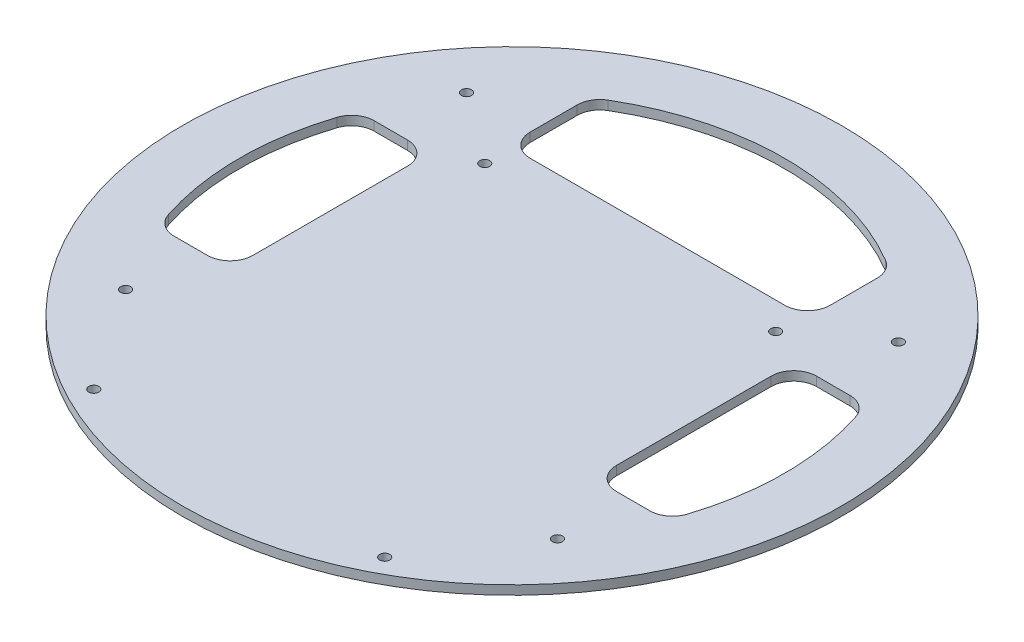
from build123d import *

# Parameters (mm, degrees)
SKETCH_2_R               = 72.5
EXTRUDE_1_DEPTH          = 2
CUT_EXTRUDE_1_DEPTH      = 103.549987811
CUT_EXTRUDE_1_DEPTH_BACK = 103.549987811
SKETCH_3_R               = 1.1
CUT_EXTRUDE_2_DEPTH      = 103.549987811


with BuildPart() as part:
    # 草图2 → 凸台-拉伸1 (new body)
    with BuildSketch(Plane(origin=(0, 0, 0), x_dir=(1, 0, 0), z_dir=(0, 1, 0))):
        Circle(SKETCH_2_R)
    extrude(amount=EXTRUDE_1_DEPTH)

    # 草图3 → 切除-拉伸1 (cut, two sides: drawn at the far end of the back side and taken through both)
    with BuildSketch(Plane.XZ.offset(-CUT_EXTRUDE_1_DEPTH_BACK)):
        with Locations((32, 60)):
            Circle(SKETCH_3_R)
        with Locations((-32, 60)):
            Circle(SKETCH_3_R)
        with Locations((-32, -26)):
            Circle(SKETCH_3_R)
        with Locations((32, -26)):
            Circle(SKETCH_3_R)
        with Locations((-47.5, 37.5)):
            Circle(SKETCH_3_R)
        with Locations((47.5, 37.5)):
            Circle(SKETCH_3_R)
        with Locations((47.5, -37.5)):
            Circle(SKETCH_3_R)
        with Locations((-47.5, -37.5)):
            Circle(SKETCH_3_R)
    extrude(amount=CUT_EXTRUDE_1_DEPTH + CUT_EXTRUDE_1_DEPTH_BACK, mode=Mode.SUBTRACT)

    # 草图4 → 切除-拉伸2 (cut, through all)
    with BuildSketch(Plane(origin=(0, 2, 0), x_dir=(1, 0, 0), z_dir=(0, 1, 0))):
        with BuildLine():
            Line((33, 47.339201514), (33, 37))
            ThreePointArc((33, 37), (31.535533906, 33.464466094), (28, 32))
            Line((28, 32), (-28, 32))
            ThreePointArc((-28, 32), (-31.535533906, 33.464466094), (-33, 37))
            Line((-33, 37), (-33, 47.339201514))
            ThreePointArc((-33, 47.339201514), (-32.343228795, 49.816369986), (-30.545454545, 51.642765288))
            ThreePointArc((-30.545454545, 51.642765288), (0, 60), (30.545454545, 51.642765288))
            ThreePointArc((30.545454545, 51.642765288), (32.343228795, 49.816369986), (33, 47.339201514))
        make_face()
        with BuildLine():
            Line((-52.306787322, 22), (-45, 22))
            ThreePointArc((-45, 22), (-41.464466094, 20.535533906), (-40, 17))
            Line((-40, 17), (-40, -17))
            ThreePointArc((-40, -17), (-41.464466094, -20.535533906), (-45, -22))
            Line((-45, -22), (-52.306787322, -22))
            ThreePointArc((-52.306787322, -22), (-55.245556391, -21.045199175), (-57.061949806, -18.545454545))
            ThreePointArc((-57.061949806, -18.545454545), (-60, 0), (-57.061949806, 18.545454545))
            ThreePointArc((-57.061949806, 18.545454545), (-55.245556391, 21.045199175), (-52.306787322, 22))
        make_face()
        with BuildLine():
            Line((52.306787322, -22), (45, -22))
            ThreePointArc((45, -22), (41.464466094, -20.535533906), (40, -17))
            Line((40, -17), (40, 17))
            ThreePointArc((40, 17), (41.464466094, 20.535533906), (45, 22))
            Line((45, 22), (52.306787322, 22))
            ThreePointArc((52.306787322, 22), (55.245556391, 21.045199175), (57.061949806, 18.545454545))
            ThreePointArc((57.061949806, 18.545454545), (60, 0), (57.061949806, -18.545454545))
            ThreePointArc((57.061949806, -18.545454545), (55.245556391, -21.045199175), (52.306787322, -22))
        make_face()
    extrude(amount=-CUT_EXTRUDE_2_DEPTH, mode=Mode.SUBTRACT)


solid = part.part
